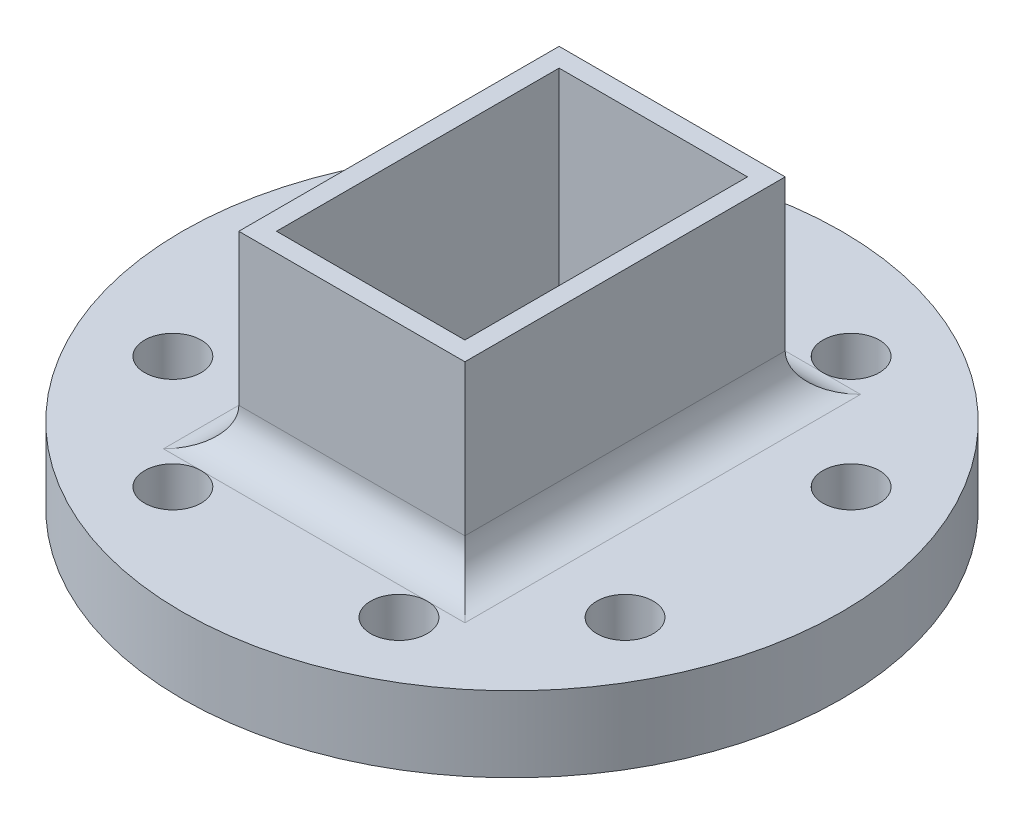
from build123d import *

# Parameters (mm, degrees)
SKETCH1_R           = 17.5
SKETCH1_R_2         = 1.5
BOSS_EXTRUDE1_DEPTH = 4
SKETCH3_W           = 12
SKETCH3_H           = 17
SKETCH3_W_2         = 10
SKETCH3_H_2         = 15
BOSS_EXTRUDE2_DEPTH = 10
FILLET1_R           = 2


with BuildPart() as part:
    # Sketch1 → Boss-Extrude1 (new body)
    with BuildSketch(Plane(origin=(0, 0, 0), x_dir=(1, 0, 0), z_dir=(0, 1, 0))):
        with Locations(Location((0, 0, 0), (0, 0, 270))):
            Circle(SKETCH1_R)
        with Locations(Location((12, 6, 0), (0, 0, 270))):
            Circle(SKETCH1_R_2, mode=Mode.SUBTRACT)
        with Locations(Location((12, -6, 0), (0, 0, 270))):
            Circle(SKETCH1_R_2, mode=Mode.SUBTRACT)
        with Locations(Location((-12, 6, 0), (0, 0, 270))):
            Circle(SKETCH1_R_2, mode=Mode.SUBTRACT)
        with Locations(Location((-12, -6, 0), (0, 0, 270))):
            Circle(SKETCH1_R_2, mode=Mode.SUBTRACT)
        with Locations(Location((6, 12, 0), (0, 0, 270))):
            Circle(SKETCH1_R_2, mode=Mode.SUBTRACT)
        with Locations(Location((6, -12, 0), (0, 0, 270))):
            Circle(SKETCH1_R_2, mode=Mode.SUBTRACT)
        with Locations(Location((-6, -12, 0), (0, 0, 270))):
            Circle(SKETCH1_R_2, mode=Mode.SUBTRACT)
        with Locations(Location((-6, 12, 0), (0, 0, 270))):
            Circle(SKETCH1_R_2, mode=Mode.SUBTRACT)
    extrude(amount=BOSS_EXTRUDE1_DEPTH)

    # Sketch3 → Boss-Extrude2 (add)
    with BuildSketch(Plane(origin=(0, 4, 0), x_dir=(1, 0, 0), z_dir=(0, 1, 0))):
        Rectangle(SKETCH3_W, SKETCH3_H)
        Rectangle(SKETCH3_W_2, SKETCH3_H_2, mode=Mode.SUBTRACT)
    extrude(amount=BOSS_EXTRUDE2_DEPTH)

    # Fillet1
    fillet1_edges = [part.edges().sort_by_distance(p)[0] for p in [
        (-6, 4, 0),
        (0, 4, 8.5),
        (6, 4, 0),
        (0, 4, -8.5),
    ]]
    fillet(fillet1_edges, radius=FILLET1_R - 0.0001)  # a hair under: the kernel refuses the full size


solid = part.part
